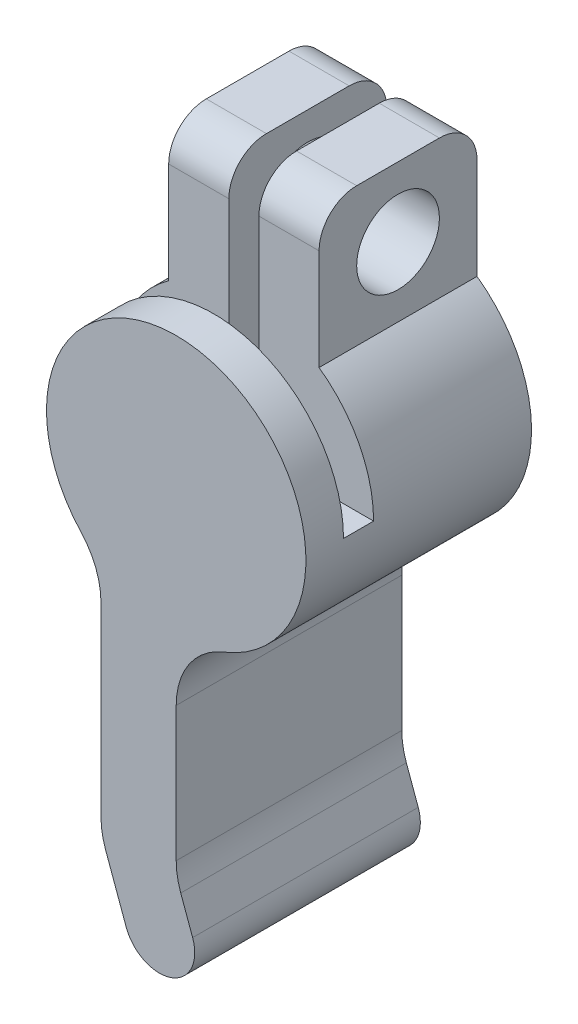
from build123d import *

# Parameters (mm, degrees)
BOSS_EXTRUDE1_DEPTH = 4.2
SKETCH2_R           = 1.1
CUT_EXTRUDE1_DEPTH  = 14.367834606
FILLET1_R           = 1
BOSS_EXTRUDE2_DEPTH = 0.8
BOSS_EXTRUDE3_DEPTH = 1
FILLET2_R           = 2


with BuildPart() as part:
    # Sketch1 → Boss-Extrude1 (new body)
    with BuildSketch(Plane.XY):
        with BuildLine():
            Line((0.436764281, -10.2), (0, -9))
            Line((0, -9), (0, -3.45))
            ThreePointArc((0, -3.45), (3.286405942, -1.049779017), (2, 2.811138559))
            Line((2, 2.811138559), (2, 6.5))
            Line((2, 6.5), (0.4, 6.5))
            Line((0.4, 6.5), (0.4, 1.393735986))
            ThreePointArc((0.4, 1.393735986), (0, -1.45), (-0.4, 1.393735986))
            Line((-0.4, 1.393735986), (-0.4, 6.5))
            Line((-0.4, 6.5), (-2, 6.5))
            Line((-2, 6.5), (-2, 2.811138559))
            ThreePointArc((-2, 2.811138559), (-3.45, 0), (-2, -2.811138559))
            Line((-2, -2.811138559), (-2, -9))
            Line((-2, -9), (-1.329280162, -10.84278761))
            ThreePointArc((-1.329280162, -10.84278761), (-0.124864136, -11.404416026), (0.436764281, -10.2))
        make_face()
    extrude(amount=BOSS_EXTRUDE1_DEPTH)

    # Sketch2 → Cut-Extrude1 (cut, through all)
    with BuildSketch(Plane.ZY.offset(2)):
        with Locations((2.1, 4.65556928)):
            Circle(SKETCH2_R)
    extrude(amount=-CUT_EXTRUDE1_DEPTH, mode=Mode.SUBTRACT)

    # Fillet1
    fillet1_edges = [part.edges().sort_by_distance(p)[0] for p in [
        (1.2, 6.5, 4.2),
        (1.2, 6.5, 0),
        (-1.2, 6.5, 4.2),
        (-1.2, 6.5, 0),
    ]]
    fillet(fillet1_edges, radius=FILLET1_R)

    # Sketch3 → Boss-Extrude2 (add)
    with BuildSketch(Plane.XY.offset(4.2)):
        with BuildLine():
            Line((-1.45, 0), (-3.45, 0))
            ThreePointArc((-3.45, 0), (-3.066145789, -1.581534065), (-2, -2.811138559))
            Line((-2, -2.811138559), (-2, -9))
            Line((-2, -9), (-1.329280162, -10.84278761))
            ThreePointArc((-1.329280162, -10.84278761), (-0.124864136, -11.404416026), (0.436764281, -10.2))
            Line((0.436764281, -10.2), (0, -9))
            Line((0, -9), (0, -3.45))
            ThreePointArc((0, -3.45), (2.439518395, -2.439518395), (3.45, 0))
            Line((3.45, 0), (1.45, 0))
            ThreePointArc((1.45, 0), (0, -1.45), (-1.45, 0))
        make_face()
    extrude(amount=BOSS_EXTRUDE2_DEPTH)

    # Sketch4 → Boss-Extrude3 (add)
    with BuildSketch(Plane.XY.offset(5)):
        with BuildLine():
            Line((-2, -2.811138559), (-2, -9))
            Line((-2, -9), (-1.329280162, -10.84278761))
            ThreePointArc((-1.329280162, -10.84278761), (-0.124864136, -11.404416026), (0.436764281, -10.2))
            Line((0.436764281, -10.2), (0, -9))
            Line((0, -9), (0, -3.45))
            ThreePointArc((0, -3.45), (1.049779017, 3.286405942), (-2, -2.811138559))
        make_face()
    extrude(amount=BOSS_EXTRUDE3_DEPTH)

    # Fillet2
    fillet2_edges = [part.edges().sort_by_distance(p)[0] for p in [
        (-2, -9, 3),
        (0, -9, 3),
        (0, -3.45, 3),
        (-2, -2.811138559, 2.5),
    ]]
    fillet(fillet2_edges, radius=FILLET2_R)


solid = part.part
